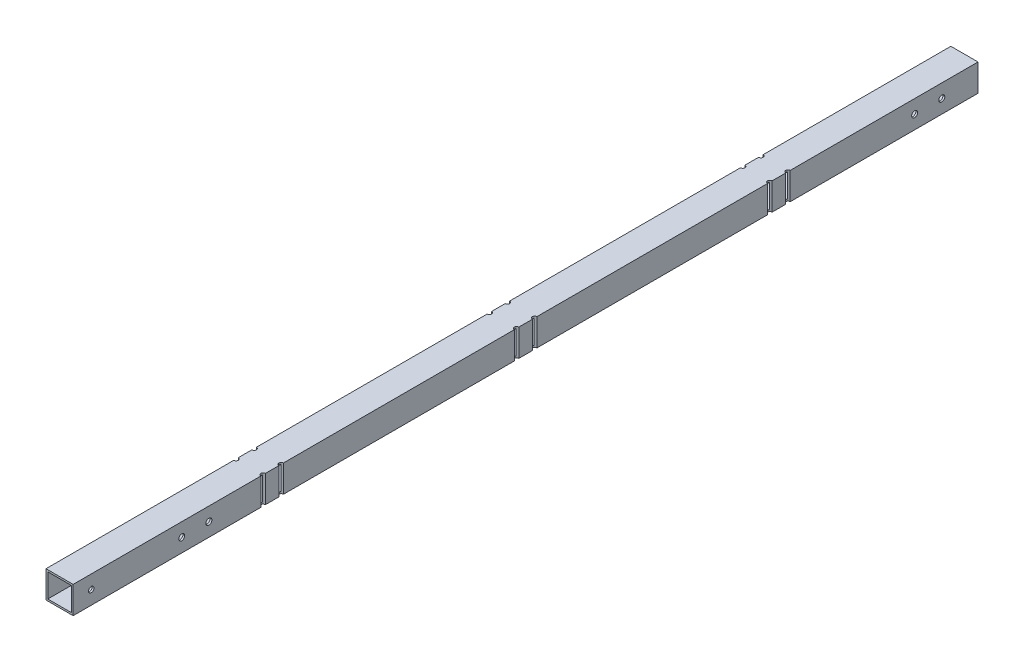
from build123d import *

# Parameters (mm, degrees)
SKETCH_1_W          = 15
SKETCH_1_H          = 15
SKETCH_1_W_2        = 13
SKETCH_1_H_2        = 13
EXTRUDE_1_DEPTH     = 800
SKETCH_4_R          = 1.5
CUT_EXTRUDE_3_DEPTH = 801.281200579
SKETCH_5_R          = 1.65
CUT_EXTRUDE_4_DEPTH = 801.281200579
SKETCH_6_W          = 15
SKETCH_6_H          = 15
CUT_EXTRUDE_5_DEPTH = 300
SKETCH_7_R          = 1.25
CUT_EXTRUDE_6_DEPTH = 155


with BuildPart() as part:
    # 草图1 → 拉伸-薄壁1 (new body)
    with BuildSketch(Plane.XY):
        with Locations((7.5, -7.5)):
            Rectangle(SKETCH_1_W, SKETCH_1_H)
        with Locations((7.5, -7.5)):
            Rectangle(SKETCH_1_W_2, SKETCH_1_H_2, mode=Mode.SUBTRACT)
    extrude(amount=EXTRUDE_1_DEPTH)

    # 草图4 → 切除-拉伸3 (cut, through all)
    with BuildSketch(Plane(origin=(15, 0, 0), x_dir=(0, 0, -1), z_dir=(1, 0, 0))):
        with Locations((-790, -7.5)):
            Circle(SKETCH_4_R)
    extrude(amount=-CUT_EXTRUDE_3_DEPTH, mode=Mode.SUBTRACT)

    # 草图5 → 切除-拉伸4 (cut, through all)
    with BuildSketch(Plane(origin=(15, 0, 0), x_dir=(0, 0, -1), z_dir=(1, 0, 0))):
        with Locations((-320, -7.5)):
            Circle(SKETCH_5_R)
        with Locations((-335, -7.5)):
            Circle(SKETCH_5_R)
        with Locations((-725, -7.5)):
            Circle(SKETCH_5_R)
        with Locations((-740, -7.5)):
            Circle(SKETCH_5_R)
    extrude(amount=-CUT_EXTRUDE_4_DEPTH, mode=Mode.SUBTRACT)

    # 草图6 → 切除-拉伸5 (cut)
    with BuildSketch(Plane(origin=(0, 0, 0), x_dir=(-1, 0, 0), z_dir=(0, 0, -1))):
        with Locations((-7.5, -7.5)):
            Rectangle(SKETCH_6_W, SKETCH_6_H)
    extrude(amount=-CUT_EXTRUDE_5_DEPTH, mode=Mode.SUBTRACT)

    # 草图7 → 切除-拉伸6 (cut)
    with BuildSketch(Plane(origin=(0, 0, 0), x_dir=(1, 0, 0), z_dir=(0, 1, 0))):
        with BuildLine():
            ThreePointArc((0, -546.25), (1.25, -545), (0, -543.75))
            Line((0, -543.75), (0, -546.25))
        make_face()
        with BuildLine():
            ThreePointArc((0, -696.25), (1.25, -695), (0, -693.75))
            Line((0, -693.75), (0, -696.25))
        make_face()
        with BuildLine():
            ThreePointArc((0, -686.25), (1.25, -685), (0, -683.75))
            Line((0, -683.75), (0, -686.25))
        make_face()
        with Locations((0, -555)):
            Circle(SKETCH_7_R)
        with BuildLine():
            Line((0, -403.75), (0, -406.25))
            ThreePointArc((0, -406.25), (1.25, -405), (0, -403.75))
        make_face()
        with BuildLine():
            Line((0, -413.75), (0, -416.25))
            ThreePointArc((0, -416.25), (1.25, -415), (0, -413.75))
        make_face()
        with BuildLine():
            Line((15, -696.25), (15, -693.75))
            ThreePointArc((15, -693.75), (13.75, -695), (15, -696.25))
        make_face()
        with BuildLine():
            Line((15, -686.25), (15, -683.75))
            ThreePointArc((15, -683.75), (13.75, -685), (15, -686.25))
        make_face()
        with BuildLine():
            Line((15, -556.25), (15, -553.75))
            ThreePointArc((15, -553.75), (13.75, -555), (15, -556.25))
        make_face()
        with BuildLine():
            ThreePointArc((15, -403.75), (13.75, -405), (15, -406.25))
            Line((15, -406.25), (15, -403.75))
        make_face()
        with BuildLine():
            ThreePointArc((15, -413.75), (13.75, -415), (15, -416.25))
            Line((15, -416.25), (15, -413.75))
        make_face()
        with BuildLine():
            Line((15, -546.25), (15, -543.75))
            ThreePointArc((15, -543.75), (13.75, -545), (15, -546.25))
        make_face()
    extrude(amount=-CUT_EXTRUDE_6_DEPTH, mode=Mode.SUBTRACT)


solid = part.part
